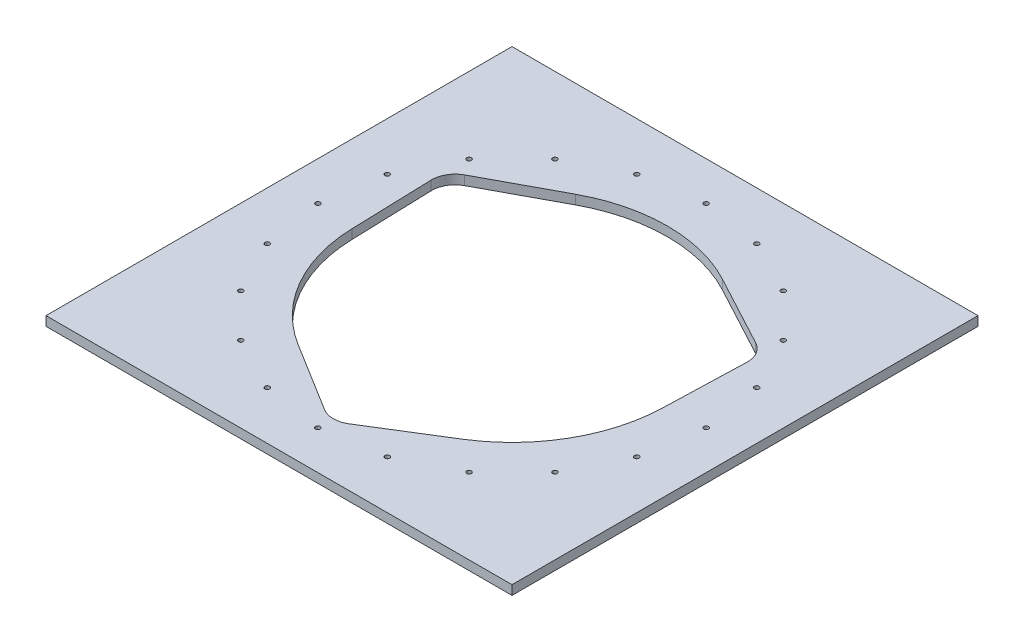
from build123d import *

# Parameters (mm, degrees)
SKETCH1_W           = 600
SKETCH1_H           = 600
SKETCH1_R           = 3
BOSS_EXTRUDE1_DEPTH = 12


with BuildPart() as part:
    # Sketch1 → Boss-Extrude1 (new body)
    with BuildSketch(Plane(origin=(0, 0, 0), x_dir=(1, 0, 0), z_dir=(0, 1, 0))):
        Rectangle(SKETCH1_W, SKETCH1_H)
        with Locations((-77.254248594, -237.764129074)):
            Circle(SKETCH1_R, mode=Mode.SUBTRACT)
        with Locations((-146.946313073, -202.254248594)):
            Circle(SKETCH1_R, mode=Mode.SUBTRACT)
        with Locations((-237.764129074, -77.254248594)):
            Circle(SKETCH1_R, mode=Mode.SUBTRACT)
        with Locations((-202.254248594, -146.946313073)):
            Circle(SKETCH1_R, mode=Mode.SUBTRACT)
        with Locations((-250, 0)):
            Circle(SKETCH1_R, mode=Mode.SUBTRACT)
        with Locations((0, -250)):
            Circle(SKETCH1_R, mode=Mode.SUBTRACT)
        with Locations((77.254248594, -237.764129074)):
            Circle(SKETCH1_R, mode=Mode.SUBTRACT)
        with Locations((146.946313073, -202.254248594)):
            Circle(SKETCH1_R, mode=Mode.SUBTRACT)
        with BuildLine():
            Line((-199.902587408, -6.241437954), (-203.190468868, 99.063784307))
            ThreePointArc((-203.190468868, 99.063784307), (-199.18584287, 115), (-187.386988239, 126.436215693))
            Line((-187.386988239, 126.436215693), (-94.546049879, 176.241437954))
            ThreePointArc((-94.546049879, 176.241437954), (0, 200), (94.546049879, 176.241437954))
            Line((94.546049879, 176.241437954), (187.386988239, 126.436215693))
            ThreePointArc((187.386988239, 126.436215693), (199.18584287, 115), (203.190468868, 99.063784307))
            Line((203.190468868, 99.063784307), (199.902587408, -6.241437954))
            ThreePointArc((199.902587408, -6.241437954), (173.205080757, -100), (105.356537529, -170))
            Line((105.356537529, -170), (15.803480629, -225.5))
            ThreePointArc((15.803480629, -225.5), (0, -230), (-15.803480629, -225.5))
            Line((-15.803480629, -225.5), (-105.356537529, -170))
            ThreePointArc((-105.356537529, -170), (-173.205080757, -100), (-199.902587408, -6.241437954))
        make_face(mode=Mode.SUBTRACT)
        with Locations((202.254248594, -146.946313073)):
            Circle(SKETCH1_R, mode=Mode.SUBTRACT)
        with Locations((237.764129074, -77.254248594)):
            Circle(SKETCH1_R, mode=Mode.SUBTRACT)
        with Locations((-237.764129074, 77.254248594)):
            Circle(SKETCH1_R, mode=Mode.SUBTRACT)
        with Locations((-202.254248594, 146.946313073)):
            Circle(SKETCH1_R, mode=Mode.SUBTRACT)
        with Locations((-146.946313073, 202.254248594)):
            Circle(SKETCH1_R, mode=Mode.SUBTRACT)
        with Locations((-77.254248594, 237.764129074)):
            Circle(SKETCH1_R, mode=Mode.SUBTRACT)
        with Locations((0, 250)):
            Circle(SKETCH1_R, mode=Mode.SUBTRACT)
        with Locations((250, 0)):
            Circle(SKETCH1_R, mode=Mode.SUBTRACT)
        with Locations((202.254248594, 146.946313073)):
            Circle(SKETCH1_R, mode=Mode.SUBTRACT)
        with Locations((237.764129074, 77.254248594)):
            Circle(SKETCH1_R, mode=Mode.SUBTRACT)
        with Locations((146.946313073, 202.254248594)):
            Circle(SKETCH1_R, mode=Mode.SUBTRACT)
        with Locations((77.254248594, 237.764129074)):
            Circle(SKETCH1_R, mode=Mode.SUBTRACT)
    extrude(amount=BOSS_EXTRUDE1_DEPTH)


solid = part.part
